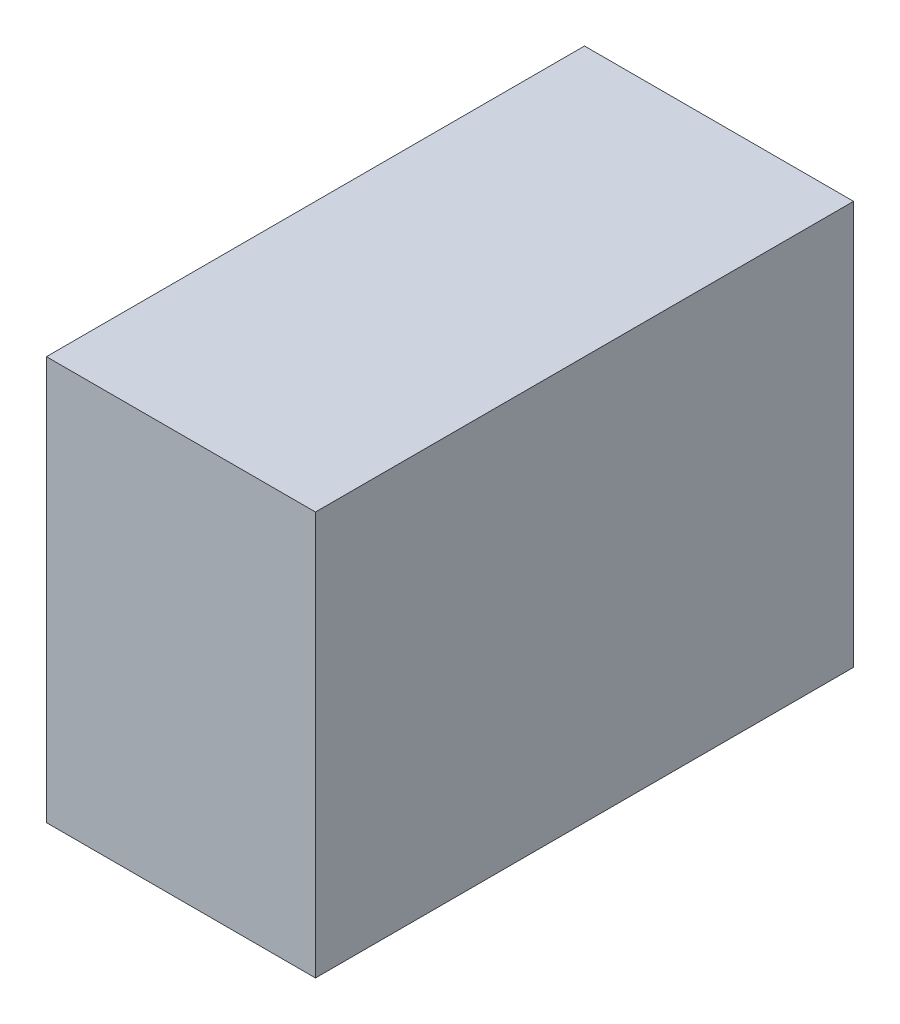
from build123d import *

# Parameters (mm, degrees)
SKETCH2_W                               = 609.6
SKETCH2_H                               = 457.2
VOLUME_ENVELOPE_DEPTH                   = 152.4
SKETCH4_W                               = 584.2
SKETCH4_H                               = 444.5
SAFE_VOLUME_DEPTH                       = 139.7
RAMP_INTERFERENCE_DEPTH                 = 152.4
DRIVE_SYSTEM_REACH                      = 412.35
SKETCH5_W                               = 63.5
SKETCH5_H                               = 63.5
DRIVE_SYSTEM_DIRECTION_2_REACH          = 412.35
DRIVE_MOTOR_DEPTH                       = 76.2
DRIVE_MOTOR_DEPTH_BACK                  = 76.2
BASE_PLATE_REACH                        = 412.35
SKETCH7_W                               = 584.2
SKETCH7_H                               = 31.75
BASE_PLATE_DIRECTION_2_REACH            = 412.35
INDENT1_START                           = 165.1
INDENT1_OUTLINE_W                       = 152.4
INDENT1_OUTLINE_H                       = 31.75
INDENT1_DEPTH                           = 127
INDENT1_START_2                         = -292.1
INDENT1_2_OUTLINE_W                     = 279.4
INDENT1_2_OUTLINE_H                     = 31.75
INDENT1_2_DEPTH                         = 63.5
INDENT1_START_3                         = 228.6
INDENT1_3_OUTLINE_W                     = 63.5
INDENT1_3_OUTLINE_H                     = 31.75
INDENT1_3_DEPTH                         = 63.5
SLIDE_SYSTEM_REACH                      = 412.35
SLIDE_SYSTEM_DIRECTION_2_REACH          = 412.35
SKETCH9_W                               = 203.2
SKETCH9_H                               = 279.4
MARIOCUTOUT_DEPTH                       = 561.097357608
SORTER_DEPTH                            = 101.6
SORTERCUTOUT_START                      = -101.6
SORTERCUTOUT_DEPTH                      = 203.2
SKETCH11_W                              = 228.6
SKETCH11_H                              = 76.2
LUMA_DEPOSITER_DEPTH                    = 101.6
MARIO_LIFTER_DEPTH                      = 76.2
KOOPER_COIN_MECHANISM_REACH             = 412.35
SKETCH13_W                              = 457.2
SKETCH13_H                              = 76.2
KOOPER_COIN_MECHANISM_DIRECTION_2_REACH = 412.35
SKETCH14_W                              = 203.2
SKETCH14_H                              = 355.6
CUT_EXTRUDE2_DEPTH                      = 466.762868851


# Read off the part's stored shape, not the designer's step: Indent1, SorterCutout
with BuildPart() as part:
    # Sketch2 → Volume Envelope (new, symmetric)
    with BuildSketch(Plane(origin=(0, 0, 0), x_dir=(0, 0, -1), z_dir=(1, 0, 0))):
        Rectangle(SKETCH2_W, SKETCH2_H)
    extrude(amount=VOLUME_ENVELOPE_DEPTH, both=True)


with BuildPart() as body_2:
    # Sketch4 → Safe Volume (new, symmetric)
    with BuildSketch(Plane(origin=(0, 0, 0), x_dir=(0, 0, -1), z_dir=(1, 0, 0))):
        with Locations((0, -6.35)):
            Rectangle(SKETCH4_W, SKETCH4_H)
    extrude(amount=SAFE_VOLUME_DEPTH, both=True)


with BuildPart() as body_3:
    # Sketch1 → Ramp Interference (new, symmetric)
    with BuildSketch(Plane(origin=(0, 0, 0), x_dir=(0, 0, -1), z_dir=(1, 0, 0))):
        Polygon((-228.6, -228.6), (-110.10738686, -196.85), (228.6, -228.6), align=None)
    extrude(amount=RAMP_INTERFERENCE_DEPTH, both=True)


with BuildPart() as body_4:

    # Drive System: up to this face of the body (flat: up to its plane)
    drive_system_end = Plane(body_2.part.faces().sort_by_distance((139.7, -6.35, 0))[0])
    # Sketch5 → Drive System (new, up to the picked face)
    with BuildSketch(Plane(origin=(0, 0, 0), x_dir=(0, 0, -1), z_dir=(1, 0, 0)), mode=Mode.PRIVATE) as drive_system_sk1:
        with Locations((-260.35, -196.85)):
            Rectangle(SKETCH5_W, SKETCH5_H)
    drive_system_tool1 = split(extrude(drive_system_sk1.sketch, amount=DRIVE_SYSTEM_REACH, mode=Mode.PRIVATE), bisect_by=drive_system_end, keep=Keep.BOTH, mode=Mode.PRIVATE)
    # Sketch5 → Drive System (new, up to the picked face)
    with BuildSketch(Plane(origin=(0, 0, 0), x_dir=(0, 0, -1), z_dir=(1, 0, 0)), mode=Mode.PRIVATE) as drive_system_sk2:
        with Locations((260.35, -196.85)):
            Rectangle(SKETCH5_W, SKETCH5_H)
    drive_system_tool2 = split(extrude(drive_system_sk2.sketch, amount=DRIVE_SYSTEM_REACH, mode=Mode.PRIVATE), bisect_by=drive_system_end, keep=Keep.BOTH, mode=Mode.PRIVATE)
    add(drive_system_tool1.solids().sort_by(Axis((0, -196.85, 260.35), (1, 0, 0)))[0])
    add(drive_system_tool2.solids().sort_by(Axis((0, -196.85, -260.35), (1, 0, 0)))[0])


    # Drive System direction 2: up to this face of the body (flat: up to its plane)
    drive_system_direction_2_end = Plane(body_2.part.faces().sort_by_distance((-139.7, -6.35, 0))[0])
    # Sketch5 → Drive System direction 2 (add, up to the picked face)
    with BuildSketch(Plane(origin=(0, 0, 0), x_dir=(0, 0, -1), z_dir=(1, 0, 0)), mode=Mode.PRIVATE) as drive_system_direction_2_sk1:
        with Locations((-260.35, -196.85)):
            Rectangle(SKETCH5_W, SKETCH5_H)
    drive_system_direction_2_tool1 = split(extrude(drive_system_direction_2_sk1.sketch, amount=-DRIVE_SYSTEM_DIRECTION_2_REACH, mode=Mode.PRIVATE), bisect_by=drive_system_direction_2_end, keep=Keep.BOTH, mode=Mode.PRIVATE)
    # Sketch5 → Drive System direction 2 (add, up to the picked face)
    with BuildSketch(Plane(origin=(0, 0, 0), x_dir=(0, 0, -1), z_dir=(1, 0, 0)), mode=Mode.PRIVATE) as drive_system_direction_2_sk2:
        with Locations((260.35, -196.85)):
            Rectangle(SKETCH5_W, SKETCH5_H)
    drive_system_direction_2_tool2 = split(extrude(drive_system_direction_2_sk2.sketch, amount=-DRIVE_SYSTEM_DIRECTION_2_REACH, mode=Mode.PRIVATE), bisect_by=drive_system_direction_2_end, keep=Keep.BOTH, mode=Mode.PRIVATE)
    add(drive_system_direction_2_tool1.solids().sort_by(Axis((0, -196.85, 260.35), (-1, 0, 0)))[0])
    add(drive_system_direction_2_tool2.solids().sort_by(Axis((0, -196.85, -260.35), (-1, 0, 0)))[0])

    # Sketch6 → Drive Motor (add, two sides: drawn at the far end of the back side and taken through both)
    with BuildSketch(Plane(origin=(0, 0, 0), x_dir=(0, 0, -1), z_dir=(1, 0, 0)).offset(-DRIVE_MOTOR_DEPTH_BACK)):
        Polygon((-228.6, -228.6), (-165.1, -211.585226281), (-165.1, -165.1), (-228.6, -165.1), align=None)
    extrude(amount=DRIVE_MOTOR_DEPTH + DRIVE_MOTOR_DEPTH_BACK)


with BuildPart() as body_5:

    # Base Plate: up to this face of the body (flat: up to its plane)
    base_plate_end = Plane(body_2.part.faces().sort_by_distance((139.7, -6.35, 0))[0])
    # Sketch7 → Base Plate (new, up to the picked face)
    with BuildSketch(Plane(origin=(0, 0, 0), x_dir=(0, 0, -1), z_dir=(1, 0, 0)), mode=Mode.PRIVATE) as base_plate_sk1:
        with Locations((0, -180.975)):
            Rectangle(SKETCH7_W, SKETCH7_H)
    base_plate_tool1 = split(extrude(base_plate_sk1.sketch, amount=BASE_PLATE_REACH, mode=Mode.PRIVATE), bisect_by=base_plate_end, keep=Keep.BOTH, mode=Mode.PRIVATE)
    add(base_plate_tool1.solids().sort_by(Axis((0, -180.975, 0), (1, 0, 0)))[0])


    # Base Plate direction 2: up to this face of the body (flat: up to its plane)
    base_plate_direction_2_end = Plane(body_2.part.faces().sort_by_distance((-139.7, -6.35, 0))[0])
    # Sketch7 → Base Plate direction 2 (add, up to the picked face)
    with BuildSketch(Plane(origin=(0, 0, 0), x_dir=(0, 0, -1), z_dir=(1, 0, 0)), mode=Mode.PRIVATE) as base_plate_direction_2_sk1:
        with Locations((0, -180.975)):
            Rectangle(SKETCH7_W, SKETCH7_H)
    base_plate_direction_2_tool1 = split(extrude(base_plate_direction_2_sk1.sketch, amount=-BASE_PLATE_DIRECTION_2_REACH, mode=Mode.PRIVATE), bisect_by=base_plate_direction_2_end, keep=Keep.BOTH, mode=Mode.PRIVATE)
    add(base_plate_direction_2_tool1.solids().sort_by(Axis((0, -180.975, 0), (-1, 0, 0)))[0])

    # Indent1 outline → Indent1 (cut)
    with BuildSketch(Plane.XY.offset(INDENT1_START)):
        with Locations((0, -180.975)):
            Rectangle(INDENT1_OUTLINE_W, INDENT1_OUTLINE_H)
    extrude(amount=INDENT1_DEPTH, mode=Mode.SUBTRACT)

    # Indent1 2 outline → Indent1 2 (cut)
    with BuildSketch(Plane.XY.offset(INDENT1_START_2)):
        with Locations((0, -180.975)):
            Rectangle(INDENT1_2_OUTLINE_W, INDENT1_2_OUTLINE_H)
    extrude(amount=INDENT1_2_DEPTH, mode=Mode.SUBTRACT)

    # Indent1 3 outline → Indent1 3 (cut)
    with BuildSketch(Plane.XY.offset(INDENT1_START_3)):
        with Locations((-107.95, -180.975)):
            Rectangle(INDENT1_3_OUTLINE_W, INDENT1_3_OUTLINE_H)
        with Locations((107.95, -180.975)):
            Rectangle(INDENT1_3_OUTLINE_W, INDENT1_3_OUTLINE_H)
    extrude(amount=INDENT1_3_DEPTH, mode=Mode.SUBTRACT)


with BuildPart() as body_6:

    # Slide System: up to this face of the body (flat: up to its plane)
    slide_system_end = Plane(body_2.part.faces().sort_by_distance((139.7, -6.35, 0))[0])
    # Sketch8 → Slide System (new, up to the picked face)
    with BuildSketch(Plane(origin=(0, 0, 0), x_dir=(0, 0, -1), z_dir=(1, 0, 0)), mode=Mode.PRIVATE) as slide_system_sk1:
        Polygon((-292.1, 120.866153447), (-292.1, 215.9), (292.1, 215.9), (292.1, 165.1), align=None)
    slide_system_tool1 = split(extrude(slide_system_sk1.sketch, amount=SLIDE_SYSTEM_REACH, mode=Mode.PRIVATE), bisect_by=slide_system_end, keep=Keep.BOTH, mode=Mode.PRIVATE)
    add(slide_system_tool1.solids().sort_by(Axis((0, 178.323466, 29.53294), (1, 0, 0)))[0])


    # Slide System direction 2: up to this face of the body (flat: up to its plane)
    slide_system_direction_2_end = Plane(body_2.part.faces().sort_by_distance((-139.7, -6.35, 0))[0])
    # Sketch8 → Slide System direction 2 (add, up to the picked face)
    with BuildSketch(Plane(origin=(0, 0, 0), x_dir=(0, 0, -1), z_dir=(1, 0, 0)), mode=Mode.PRIVATE) as slide_system_direction_2_sk1:
        Polygon((-292.1, 120.866153447), (-292.1, 215.9), (292.1, 215.9), (292.1, 165.1), align=None)
    slide_system_direction_2_tool1 = split(extrude(slide_system_direction_2_sk1.sketch, amount=-SLIDE_SYSTEM_DIRECTION_2_REACH, mode=Mode.PRIVATE), bisect_by=slide_system_direction_2_end, keep=Keep.BOTH, mode=Mode.PRIVATE)
    add(slide_system_direction_2_tool1.solids().sort_by(Axis((0, 178.323466, 29.53294), (-1, 0, 0)))[0])

    # Sketch9 → MarioCutout (cut, through all)
    with BuildSketch(Plane(origin=(0, 215.9, 0), x_dir=(1, 0, 0), z_dir=(0, 1, 0))):
        Rectangle(SKETCH9_W, SKETCH9_H)
    extrude(amount=-MARIOCUTOUT_DEPTH, mode=Mode.SUBTRACT)

    # SorterCutout outline → SorterCutout (cut)
    with BuildSketch(Plane.YZ.offset(SORTERCUTOUT_START)):
        Polygon((129.520601685, 177.8), (215.9, 177.8), (215.9, 292.1), (120.866153447, 292.1), align=None)
    extrude(amount=SORTERCUTOUT_DEPTH, mode=Mode.SUBTRACT)


with BuildPart() as body_7:
    # Sketch10 → Sorter (new, symmetric)
    with BuildSketch(Plane(origin=(0, 0, 0), x_dir=(0, 0, -1), z_dir=(1, 0, 0))):
        Polygon((-292.1, 120.866153447), (-177.8, 129.520601685), (-177.8, 215.9), (-292.1, 215.9), align=None)
    extrude(amount=SORTER_DEPTH, both=True)


with BuildPart() as body_8:
    # Sketch11 → Luma Depositer (new, symmetric)
    with BuildSketch(Plane(origin=(0, 0, 0), x_dir=(0, 0, -1), z_dir=(1, 0, 0))):
        with Locations((-177.8, 63.5)):
            Rectangle(SKETCH11_W, SKETCH11_H)
    extrude(amount=LUMA_DEPOSITER_DEPTH, both=True)


with BuildPart() as body_9:
    # Sketch12 → Mario Lifter (new, symmetric)
    with BuildSketch(Plane(origin=(0, 0, 0), x_dir=(0, 0, -1), z_dir=(1, 0, 0))):
        Polygon((-88.9, 215.9), (-88.9, 114.3), (-32.572391225, 114.3), (50.8, -196.85), (127, -196.85), (43.627608775, 114.3), (114.3, 114.3), (114.3, 215.9), align=None)
    extrude(amount=MARIO_LIFTER_DEPTH, both=True)


with BuildPart() as body_10:

    # Kooper/Coin Mechanism: up to this face of the body (flat: up to its plane)
    kooper_coin_mechanism_end = Plane(body_2.part.faces().sort_by_distance((139.7, -6.35, 0))[0])
    # Sketch13 → Kooper/Coin Mechanism (new, up to the picked face)
    with BuildSketch(Plane(origin=(0, 0, 0), x_dir=(0, 0, -1), z_dir=(1, 0, 0)), mode=Mode.PRIVATE) as kooper_coin_mechanism_sk1:
        with Locations((63.5, -127)):
            Rectangle(SKETCH13_W, SKETCH13_H)
    kooper_coin_mechanism_tool1 = split(extrude(kooper_coin_mechanism_sk1.sketch, amount=KOOPER_COIN_MECHANISM_REACH, mode=Mode.PRIVATE), bisect_by=kooper_coin_mechanism_end, keep=Keep.BOTH, mode=Mode.PRIVATE)
    add(kooper_coin_mechanism_tool1.solids().sort_by(Axis((0, -127, -63.5), (1, 0, 0)))[0])


    # Kooper/Coin Mechanism direction 2: up to this face of the body (flat: up to its plane)
    kooper_coin_mechanism_direction_2_end = Plane(body_2.part.faces().sort_by_distance((-139.7, -6.35, 0))[0])
    # Sketch13 → Kooper/Coin Mechanism direction 2 (add, up to the picked face)
    with BuildSketch(Plane(origin=(0, 0, 0), x_dir=(0, 0, -1), z_dir=(1, 0, 0)), mode=Mode.PRIVATE) as kooper_coin_mechanism_direction_2_sk1:
        with Locations((63.5, -127)):
            Rectangle(SKETCH13_W, SKETCH13_H)
    kooper_coin_mechanism_direction_2_tool1 = split(extrude(kooper_coin_mechanism_direction_2_sk1.sketch, amount=-KOOPER_COIN_MECHANISM_DIRECTION_2_REACH, mode=Mode.PRIVATE), bisect_by=kooper_coin_mechanism_direction_2_end, keep=Keep.BOTH, mode=Mode.PRIVATE)
    add(kooper_coin_mechanism_direction_2_tool1.solids().sort_by(Axis((0, -127, -63.5), (-1, 0, 0)))[0])

    # Sketch14 → Cut-Extrude2 (cut, through all)
    with BuildSketch(Plane(origin=(0, -88.9, 0), x_dir=(1, 0, 0), z_dir=(0, 1, 0))):
        with Locations((0, 114.3)):
            Rectangle(SKETCH14_W, SKETCH14_H)
    extrude(amount=-CUT_EXTRUDE2_DEPTH, mode=Mode.SUBTRACT)


solid = Compound([part.part, body_2.part, body_3.part, body_4.part, body_5.part, body_6.part, body_7.part, body_8.part, body_9.part, body_10.part])
